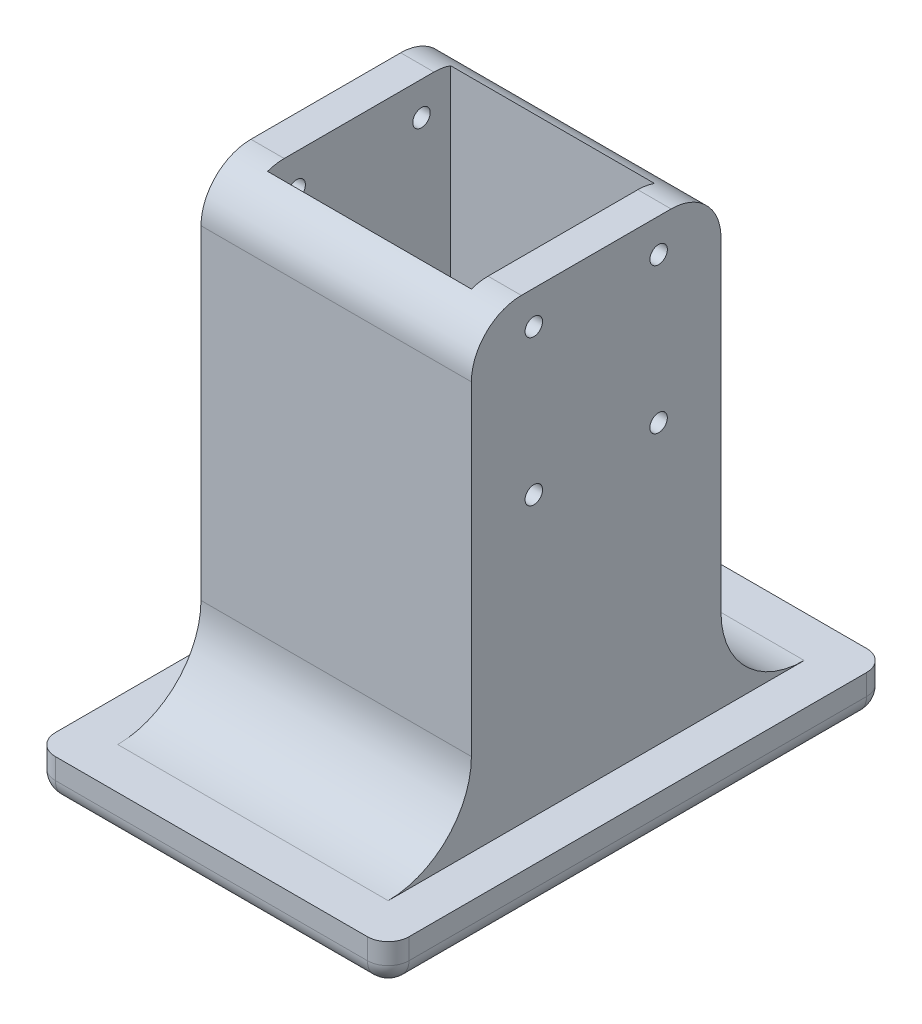
from build123d import *

# Parameters (mm, degrees)
SKETCH_1_W          = 85
SKETCH_1_H          = 120
EXTRUDE_1_DEPTH     = 10
SKETCH_2_W          = 65
SKETCH_2_H          = 60
SKETCH_2_W_2        = 49
SKETCH_2_H_2        = 44
EXTRUDE_2_DEPTH     = 110
FILLET_1_R          = 5
FILLET_2_R          = 12
SKETCH_3_R          = 2.1
CUT_EXTRUDE_1_DEPTH = 159.823801743
FILLET_3_R          = 20


with BuildPart() as part:
    # 草图1 → 凸台-拉伸1 (new body)
    with BuildSketch(Plane(origin=(0, 0, 0), x_dir=(1, 0, 0), z_dir=(0, 1, 0))):
        Rectangle(SKETCH_1_W, SKETCH_1_H)
    extrude(amount=EXTRUDE_1_DEPTH)

    # 草图2 → 凸台-拉伸2 (add)
    with BuildSketch(Plane(origin=(0, 10, 0), x_dir=(1, 0, 0), z_dir=(0, 1, 0))):
        Rectangle(SKETCH_2_W, SKETCH_2_H)
        Rectangle(SKETCH_2_W_2, SKETCH_2_H_2, mode=Mode.SUBTRACT)
    extrude(amount=EXTRUDE_2_DEPTH)

    # 圆角1
    fillet_1_edges = [part.edges().sort_by_distance(p)[0] for p in [
        (0, 0, -60),
        (42.5, 0, 0),
        (0, 0, 60),
        (-42.5, 0, 0),
        (-42.5, 5, -60),
        (42.5, 5, -60),
        (42.5, 5, 60),
        (-42.5, 5, 60),
    ]]
    fillet(fillet_1_edges, radius=FILLET_1_R)

    # 圆角2
    # the kernel refuses this fillet: 12 mm, written as the material it takes off along each edge
    with BuildSketch(Plane(origin=(62.5, 120, 30), x_dir=(0, -1, 0), z_dir=(-1, 0, 0)), Plane(origin=(-62.5, 120, -30), x_dir=(0, -1, 0), z_dir=(1, 0, 0))) as fillet_2_piece_1:
        with BuildLine():
            CenterArc((FILLET_2_R, -FILLET_2_R), FILLET_2_R, 90, 90)
            Line((0, -FILLET_2_R), (0, 0))
            Line((0, 0), (FILLET_2_R, 0))
        make_face()
    extrude(amount=125, mode=Mode.SUBTRACT)

    # 草图3 → 切除-拉伸1 (cut, through all)
    with BuildSketch(Plane(origin=(42.5, 0, 0), x_dir=(0, 0, -1), z_dir=(1, 0, 0))):
        with Locations(Location((-15, 112, 0), (0, 0, 180))):
            Circle(SKETCH_3_R)
        with Locations(Location((15, 112, 0), (0, 0, 180))):
            Circle(SKETCH_3_R)
        with Locations(Location((15, 77, 0), (0, 0, 180))):
            Circle(SKETCH_3_R)
        with Locations(Location((-15, 77, 0), (0, 0, 180))):
            Circle(SKETCH_3_R)
    extrude(amount=-CUT_EXTRUDE_1_DEPTH, mode=Mode.SUBTRACT)

    # 圆角3
    fillet_3_edges = [part.edges().sort_by_distance(p)[0] for p in [
        (0, 10, 30),
        (0, 10, -30),
    ]]
    fillet(fillet_3_edges, radius=FILLET_3_R)


solid = part.part
